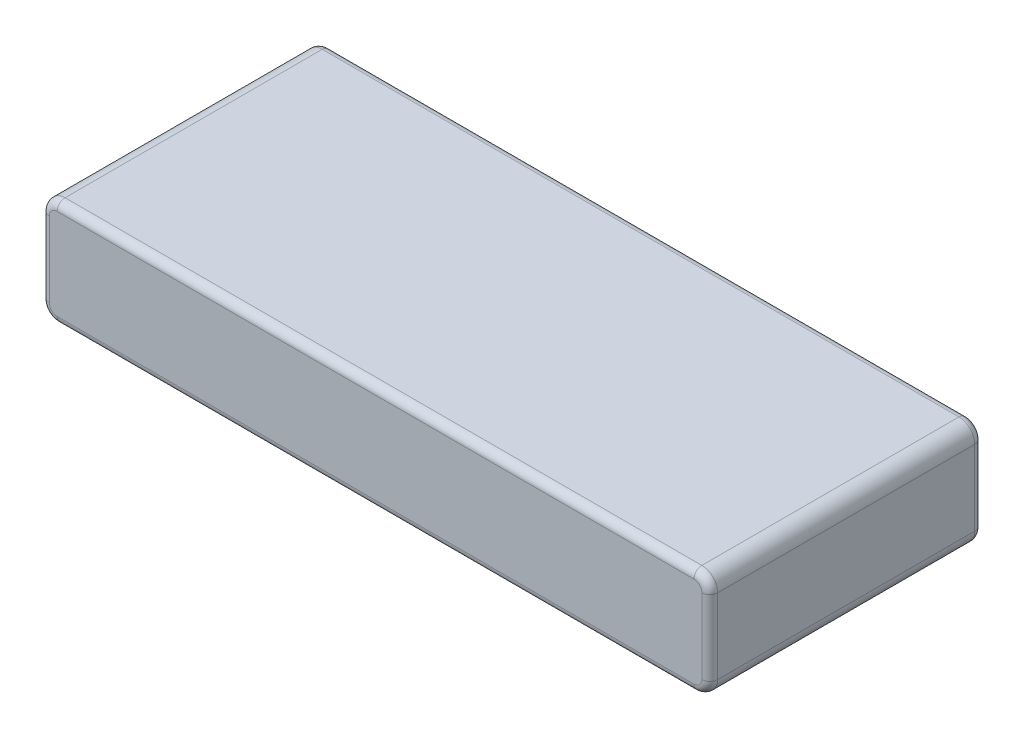
from build123d import *

# Parameters (mm, degrees)
SZKIC1_W                    = 169
SZKIC1_H                    = 69
DODANIE_WYCI_GNI_CIE1_DEPTH = 27
DODANIE_WYCI_GNI_CIE2_DEPTH = 10
ZAOKR_GLENIE1_R             = 4
ZAOKR_GLENIE2_R             = 2


with BuildPart() as part:
    # Szkic1 → Dodanie-wyciągnięcie1 (new body)
    with BuildSketch(Plane(origin=(0, 0, 0), x_dir=(1, 0, 0), z_dir=(0, 1, 0))):
        Rectangle(SZKIC1_W, SZKIC1_H)
    extrude(amount=DODANIE_WYCI_GNI_CIE1_DEPTH)

    # Szkic2 → Dodanie-wyciągnięcie2 (add)
    with BuildSketch(Plane.ZY.offset(84.5)):
        with BuildLine():
            ThreePointArc((-13.696730104, 11.722390271), (-12.293830846, 11.74736365), (-13.362523627, 12.656564254))
            ThreePointArc((-13.362523627, 12.656564254), (-14.765422886, 12.631590875), (-13.696730104, 11.722390271))
        make_face()
    extrude(amount=DODANIE_WYCI_GNI_CIE2_DEPTH)

    # Zaokrąglenie1
    zaokr_glenie1_edges = [part.edges().sort_by_distance(p)[0] for p in [
        (84.5, 0, 0),
        (84.5, 27, 0),
        (-84.5, 0, 0),
        (-84.5, 27, 0),
    ]]
    fillet(zaokr_glenie1_edges, radius=ZAOKR_GLENIE1_R)

    # Zaokrąglenie2
    zaokr_glenie2_edges = [part.edges().sort_by_distance(p)[0] for p in [
        (83.328427125, 25.828427125, 34.5),
        (84.5, 13.5, 34.5),
        (83.328427125, 1.171572875, 34.5),
        (0, 0, 34.5),
        (-83.328427125, 1.171572875, 34.5),
        (-84.5, 13.5, 34.5),
        (-83.328427125, 25.828427125, 34.5),
        (83.328427125, 25.828427125, -34.5),
        (84.5, 13.5, -34.5),
        (83.328427125, 1.171572875, -34.5),
        (-83.328427125, 1.171572875, -34.5),
        (-83.328427125, 25.828427125, -34.5),
        (-84.5, 13.5, -34.5),
        (0, 27, 34.5),
        (0, 0, -34.5),
        (0, 27, -34.5),
    ]]
    fillet(zaokr_glenie2_edges, radius=ZAOKR_GLENIE2_R)


solid = part.part
